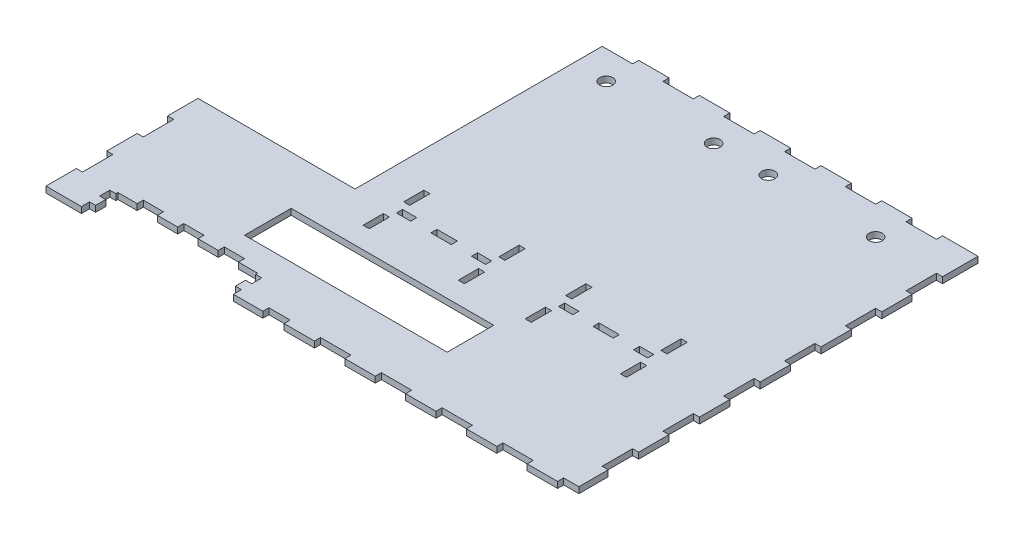
from build123d import *

# Parameters (mm, degrees)
CROQUIS1_R              = 3.25
CROQUIS1_W              = 10
CROQUIS1_H              = 3
CROQUIS1_W_2            = 3
CROQUIS1_H_2            = 10
CROQUIS1_W_3            = 7
SALIENTE_EXTRUIR1_DEPTH = 3


with BuildPart() as part:
    # Croquis1 → Saliente-Extruir1 (new body)
    with BuildSketch(Plane(origin=(0, 0, 0), x_dir=(1, 0, 0), z_dir=(0, 1, 0))):
        Polygon((17.5, 79), (20.5, 79), (20.5, 80), (25.626440042, 80), (30, 80), (30, 83), (40, 83), (40, 80), (50, 80), (50, 83), (60, 83), (60, 80), (70, 80), (70, 83), (80, 83), (80, 80), (84.373559958, 80), (89.5, 80), (89.5, 79), (92.5, 79), (92.5, 74), (89.5, 74), (89.5, 69), (92.5, 69), (92.5, 65), (107, 65), (107, 68), (117.5, 68), (117.5, 65), (132.5, 65), (132.5, 68), (147.5, 68), (147.5, 65), (162.5, 65), (162.5, 68), (177.5, 68), (177.5, 65), (192.5, 65), (192.5, 68), (207.5, 68), (207.5, 65), (222.5, 65), (222.5, 68), (237.5, 68), (237.5, 65), (252.5, 65), (252.5, 68), (260, 68), (260, 82.5), (257, 82.5), (257, 97.5), (260, 97.5), (260, 112.5), (257, 112.5), (257, 127.5), (260, 127.5), (260, 142.5), (257, 142.5), (257, 157.5), (260, 157.5), (260, 172.5), (257, 172.5), (257, 187.5), (260, 187.5), (260, 202.5), (257, 202.5), (257, 217.5), (260, 217.5), (260, 232.5), (257, 232.5), (257, 247.5), (260, 247.5), (260, 265), (242.5, 265), (242.5, 262), (227.5, 262), (227.5, 265), (212.5, 265), (212.5, 262), (197.5, 262), (197.5, 265), (182.5, 265), (182.5, 262), (167.5, 262), (167.5, 265), (152.5, 265), (152.5, 262), (137.5, 262), (137.5, 265), (122.5, 265), (122.5, 262), (107.5, 262), (107.5, 265), (92.5, 265), (92.5, 262), (77.5, 262), (77.5, 155), (77.5, 140), (3, 140), (0, 140), (0, 125), (3, 125), (3, 110), (0, 110), (0, 95), (3, 95), (3, 80), (0, 80), (0, 65), (17.5, 65), (17.5, 69), (20.5, 69), (20.5, 74), (17.5, 74), align=None)
        with Locations((173.5, 248)):
            Circle(CROQUIS1_R, mode=Mode.SUBTRACT)
        with Locations((93.5, 248)):
            Circle(CROQUIS1_R, mode=Mode.SUBTRACT)
        with Locations((146.5, 248)):
            Circle(CROQUIS1_R, mode=Mode.SUBTRACT)
        with Locations((226.5, 248)):
            Circle(CROQUIS1_R, mode=Mode.SUBTRACT)
        with Locations((120, 141.5)):
            Rectangle(CROQUIS1_W, CROQUIS1_H, mode=Mode.SUBTRACT)
        Polygon((120, 93), (70, 93), (70, 116), (170, 116), (170, 93), align=None, mode=Mode.SUBTRACT)
        with Locations((200, 141.5)):
            Rectangle(CROQUIS1_W, CROQUIS1_H, mode=Mode.SUBTRACT)
        with Locations((96.5, 151.5)):
            Rectangle(CROQUIS1_W_2, CROQUIS1_H_2, mode=Mode.SUBTRACT)
        with Locations((96.5, 131.5)):
            Rectangle(CROQUIS1_W_2, CROQUIS1_H_2, mode=Mode.SUBTRACT)
        with Locations((101.5, 141.5)):
            Rectangle(CROQUIS1_W_3, CROQUIS1_H, mode=Mode.SUBTRACT)
        with Locations((143.5, 151.5)):
            Rectangle(CROQUIS1_W_2, CROQUIS1_H_2, mode=Mode.SUBTRACT)
        with Locations((143.5, 131.5)):
            Rectangle(CROQUIS1_W_2, CROQUIS1_H_2, mode=Mode.SUBTRACT)
        with Locations((176.5, 151.5)):
            Rectangle(CROQUIS1_W_2, CROQUIS1_H_2, mode=Mode.SUBTRACT)
        with Locations((138.5, 141.5)):
            Rectangle(CROQUIS1_W_3, CROQUIS1_H, mode=Mode.SUBTRACT)
        with Locations((181.5, 141.5)):
            Rectangle(CROQUIS1_W_3, CROQUIS1_H, mode=Mode.SUBTRACT)
        with Locations((223.5, 151.5)):
            Rectangle(CROQUIS1_W_2, CROQUIS1_H_2, mode=Mode.SUBTRACT)
        with Locations((218.5, 141.5)):
            Rectangle(CROQUIS1_W_3, CROQUIS1_H, mode=Mode.SUBTRACT)
        with Locations((176.5, 131.5)):
            Rectangle(CROQUIS1_W_2, CROQUIS1_H_2, mode=Mode.SUBTRACT)
        with Locations((223.5, 131.5)):
            Rectangle(CROQUIS1_W_2, CROQUIS1_H_2, mode=Mode.SUBTRACT)
    extrude(amount=SALIENTE_EXTRUIR1_DEPTH)


solid = part.part
